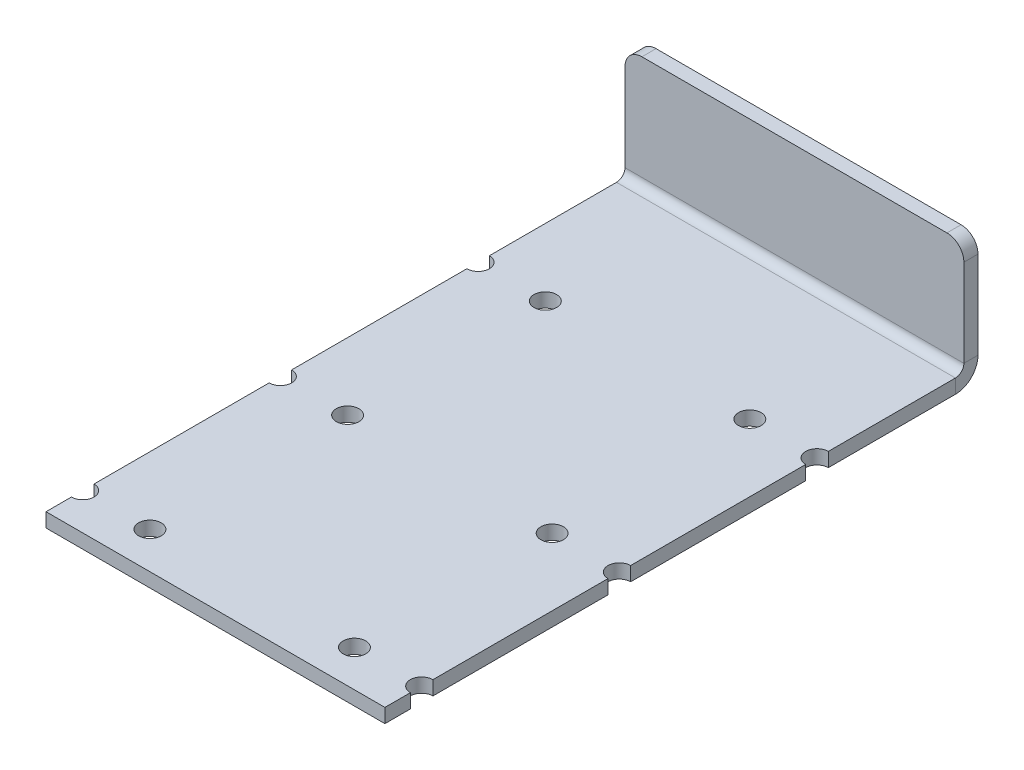
from build123d import *

# Parameters (mm, degrees)
BASE_FLANGE2_DEPTH           = 5
EDGE_FLANGE3_STRIP_W         = 26
EDGE_FLANGE3_STRIP_H         = 5
EDGE_FLANGE3_STRIP_CUT_DEPTH = 120
EDGE_FLANGE3_DEPTH           = 120
SKETCH18_R                   = 4
CUT_EXTRUDE1_DEPTH           = 10


# Sheet-metal steps are written as plain solids
with BuildPart() as part:
    # Sketch1 → Base-Flange2 (new body)
    with BuildSketch(Plane.XY):
        with BuildLine():
            Line((60, 66.5), (60, 100.5))
            ThreePointArc((60, 100.5), (58.242640687, 104.742640687), (54, 106.5))
            Line((54, 106.5), (-54, 106.5))
            ThreePointArc((-54, 106.5), (-58.242640687, 104.742640687), (-60, 100.5))
            Line((-60, 100.5), (-60, 66.5))
            Line((-60, 66.5), (60, 66.5))
        make_face()
    extrude(amount=BASE_FLANGE2_DEPTH)

    # Edge-Flange3 strip (across the edge) → Edge-Flange3 strip cut (cut)
    with BuildSketch(Plane(origin=(-60, 66.5, 5), x_dir=(0, 1, 0), z_dir=(1, 0, 0))):
        with Locations((-10, -2.5)):
            Rectangle(EDGE_FLANGE3_STRIP_W, EDGE_FLANGE3_STRIP_H)
    extrude(amount=EDGE_FLANGE3_STRIP_CUT_DEPTH, mode=Mode.SUBTRACT)

    # Edge-Flange3 section (across the edge) → Edge-Flange3 (add)
    with BuildSketch(Plane(origin=(-60, 66.5, 5), x_dir=(0, 1, 0), z_dir=(1, 0, 0))):
        with BuildLine():
            Line((-5, 3), (-5, 205))
            Line((-5, 205), (0, 205))
            Line((0, 205), (0, 3))
            ThreePointArc((0, 3), (0.878679656, 0.878679656), (3, 0))
            Line((3, 0), (3, -5))
            ThreePointArc((3, -5), (-2.656854249, -2.656854249), (-5, 3))
        make_face()
    extrude(amount=EDGE_FLANGE3_DEPTH)

    # Sketch18 → Cut-Extrude1 (cut)
    with BuildSketch(Plane(origin=(0, 66.5, 0), x_dir=(1, 0, 0), z_dir=(0, 1, 0))):
        with Locations(Location((36.205, -197, 0), (0, 0, 270))):
            Circle(SKETCH18_R)
        with Locations(Location((-36.205, -197, 0), (0, 0, 270))):
            Circle(SKETCH18_R)
        with Locations(Location((-36.205, -127, 0), (0, 0, 270))):
            Circle(SKETCH18_R)
        with Locations(Location((36.205, -127, 0), (0, 0, 270))):
            Circle(SKETCH18_R)
        with Locations(Location((36.205, -57, 0), (0, 0, 270))):
            Circle(SKETCH18_R)
        with Locations(Location((-36.205, -57, 0), (0, 0, 270))):
            Circle(SKETCH18_R)
        with Locations((-60, -197)):
            Circle(SKETCH18_R)
        with Locations((-60, -127)):
            Circle(SKETCH18_R)
        with Locations((-60, -57)):
            Circle(SKETCH18_R)
        with Locations((60, -197)):
            Circle(SKETCH18_R)
        with Locations((60, -127)):
            Circle(SKETCH18_R)
        with Locations((60, -57)):
            Circle(SKETCH18_R)
    extrude(amount=-CUT_EXTRUDE1_DEPTH, mode=Mode.SUBTRACT)


solid = part.part
